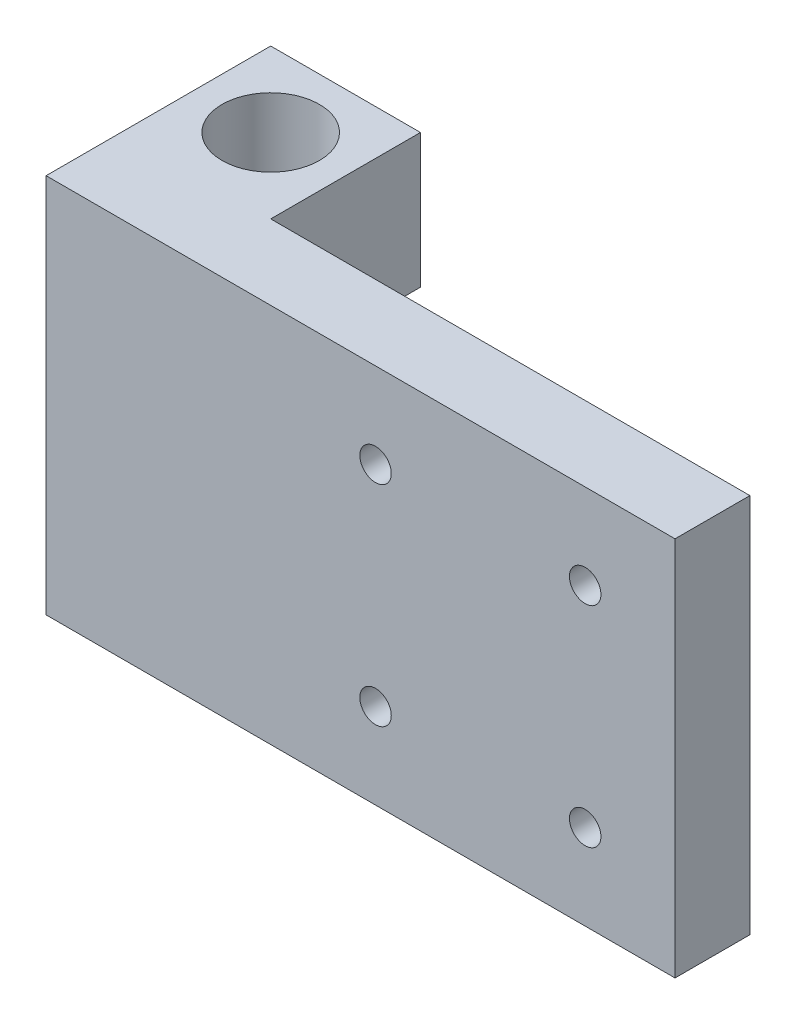
from build123d import *

# Parameters (mm, degrees)
SKETCH1_W           = 84
SKETCH1_H           = 50.8
SKETCH1_R           = 2.1
BOSS_EXTRUDE1_DEPTH = 10
SKETCH3_W           = 20
SKETCH3_H           = 50.8
BOSS_EXTRUDE2_DEPTH = 20
SKETCH5_R           = 6.5
CUT_EXTRUDE1_DEPTH  = 10
CUT_EXTRUDE2_START  = -10
SKETCH6_R           = 6.5
CUT_EXTRUDE2_DEPTH  = 10
SKETCH7_W           = 10
SKETCH7_H           = 15
CUT_EXTRUDE3_DEPTH  = 10


with BuildPart() as part:
    # Sketch1 → Boss-Extrude1 (new body)
    with BuildSketch(Plane.XY):
        with Locations((42, 25.4)):
            Rectangle(SKETCH1_W, SKETCH1_H)
        with Locations((72, 39.4)):
            Circle(SKETCH1_R, mode=Mode.SUBTRACT)
        with Locations((72, 11.4)):
            Circle(SKETCH1_R, mode=Mode.SUBTRACT)
        with Locations((44, 39.4)):
            Circle(SKETCH1_R, mode=Mode.SUBTRACT)
        with Locations((44, 11.4)):
            Circle(SKETCH1_R, mode=Mode.SUBTRACT)
    extrude(amount=BOSS_EXTRUDE1_DEPTH)

    # Sketch3 → Boss-Extrude2 (add)
    with BuildSketch(Plane(origin=(0, 0, 0), x_dir=(-1, 0, 0), z_dir=(0, 0, -1))):
        with Locations((-10, 25.4)):
            Rectangle(SKETCH3_W, SKETCH3_H)
    extrude(amount=BOSS_EXTRUDE2_DEPTH)

    # Sketch5 → Cut-Extrude1 (cut)
    with BuildSketch(Plane(origin=(0, 50.8, 0), x_dir=(1, 0, 0), z_dir=(0, 1, 0))):
        with Locations((10, 10)):
            Circle(SKETCH5_R)
    extrude(amount=-CUT_EXTRUDE1_DEPTH, mode=Mode.SUBTRACT)

    # Sketch6 → Cut-Extrude2 (cut)
    with BuildSketch(Plane.XZ.offset(CUT_EXTRUDE2_START)):
        with Locations((10, -10)):
            Circle(SKETCH6_R)
    extrude(amount=CUT_EXTRUDE2_DEPTH, mode=Mode.SUBTRACT)

    # Sketch7 → Cut-Extrude3 (cut)
    with BuildSketch(Plane(origin=(0, 0, -20), x_dir=(-1, 0, 0), z_dir=(0, 0, -1))):
        with Locations((-15, 25.4)):
            Rectangle(SKETCH7_W, SKETCH7_H)
    extrude(amount=-CUT_EXTRUDE3_DEPTH, mode=Mode.SUBTRACT)


solid = part.part
